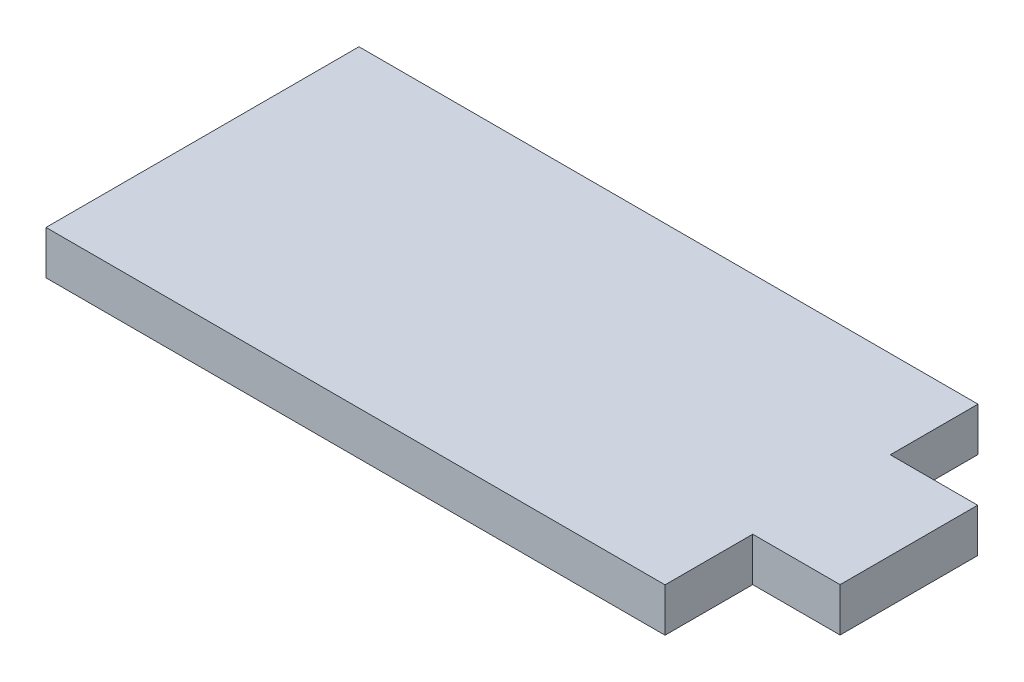
from build123d import *

# Parameters (mm, degrees)
BOSS_EXTRUDE1_DEPTH = 3.175


with BuildPart() as part:
    # Sketch1 → Boss-Extrude1 (new body)
    with BuildSketch(Plane(origin=(0, 0, 0), x_dir=(1, 0, 0), z_dir=(0, 1, 0))):
        Polygon((22.5, 6.375), (-22.5, 6.375), (-22.5, 0), (-22.5, -10), (-22.5, -16.375), (22.5, -16.375), (22.5, -10), (28.85, -10), (28.85, 0), (22.5, 0), align=None)
    extrude(amount=BOSS_EXTRUDE1_DEPTH)


solid = part.part
